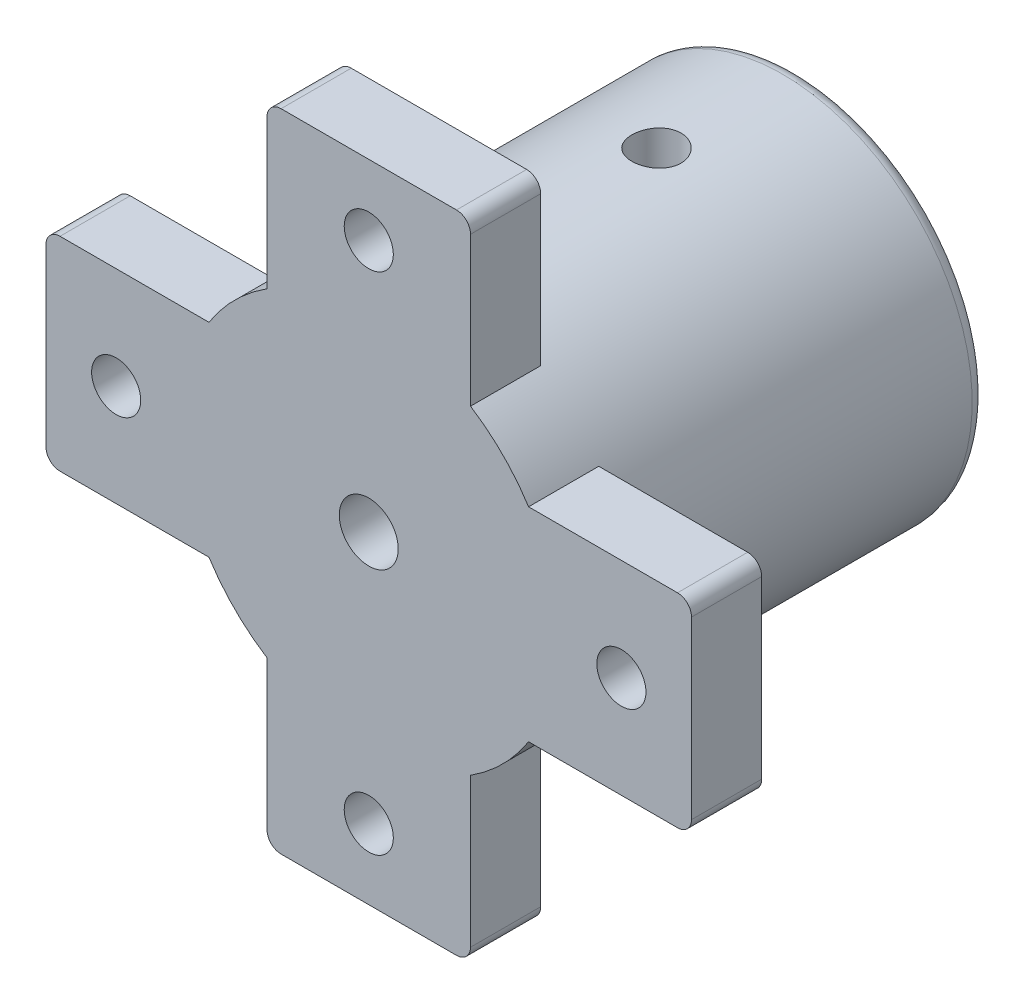
from build123d import *
from build123d.topology import SkipClean

# Parameters (mm, degrees)
SKETCH1_R               = 13.5
SKETCH1_R_2             = 2.1
BOSS_EXTRUDE1_DEPTH     = 5.5
SKETCH2_R               = 13.5
SKETCH2_R_2             = 2.1
BOSS_EXTRUDE2_DEPTH     = 5
SKETCH4_W               = 14.5
SKETCH4_H               = 15
SKETCH4_W_2             = 15
SKETCH4_H_2             = 14.5
BOSS_EXTRUDE4_DEPTH     = 5
CUT_EXTRUDE1_REACH      = 34.989
SKETCH5_R               = 1.75
BOSS_EXTRUDE5_START     = 20
SKETCH6_R               = 13.5
BOSS_EXTRUDE5_DEPTH     = 20
CUT_EXTRUDE2_DEPTH      = 39.183766184
CUT_EXTRUDE2_DEPTH_BACK = 39.183766184
SKETCH7_R               = 1.75
FILLET5_R               = 1
FILLET6_R               = 1


with BuildPart() as part:
    # Sketch1 → Boss-Extrude1 (new body)
    with BuildSketch(Plane.XY):
        Circle(SKETCH1_R)
        Circle(SKETCH1_R_2, mode=Mode.SUBTRACT)
    extrude(amount=BOSS_EXTRUDE1_DEPTH)

    # Sketch2 → Boss-Extrude2 (add)
    with BuildSketch(Plane.XY.offset(5.5)):
        Circle(SKETCH2_R)
        Circle(SKETCH2_R_2, mode=Mode.SUBTRACT)
    extrude(amount=BOSS_EXTRUDE2_DEPTH)

    # Sketch4 → Boss-Extrude4 (add)
    with BuildSketch(Plane.XY.offset(10.5)):
        with Locations((0, 15.5)):
            Rectangle(SKETCH4_W, SKETCH4_H)
        with Locations((15.5, 0)):
            Rectangle(SKETCH4_W_2, SKETCH4_H_2)
        with Locations((-15.5, 0)):
            Rectangle(SKETCH4_W_2, SKETCH4_H_2)
        with Locations((0, -15.5)):
            Rectangle(SKETCH4_W, SKETCH4_H)
    extrude(amount=-BOSS_EXTRUDE4_DEPTH)

    # Sketch5 → Cut-Extrude1 (cut, up to next)
    with BuildSketch(Plane(origin=(0, 0, 5.5), x_dir=(-1, 0, 0), z_dir=(0, 0, -1)), mode=Mode.PRIVATE) as cut_extrude1_sk1:
        with Locations((18, 0)):
            Circle(SKETCH5_R)
    cut_extrude1_tool1 = extrude(cut_extrude1_sk1.sketch, amount=-CUT_EXTRUDE1_REACH, mode=Mode.PRIVATE) & part.part
    # Sketch5 → Cut-Extrude1 (cut, up to next)
    with BuildSketch(Plane(origin=(0, 0, 5.5), x_dir=(-1, 0, 0), z_dir=(0, 0, -1)), mode=Mode.PRIVATE) as cut_extrude1_sk2:
        with Locations((-18, 0)):
            Circle(SKETCH5_R)
    cut_extrude1_tool2 = extrude(cut_extrude1_sk2.sketch, amount=-CUT_EXTRUDE1_REACH, mode=Mode.PRIVATE) & part.part
    # Sketch5 → Cut-Extrude1 (cut, up to next)
    with BuildSketch(Plane(origin=(0, 0, 5.5), x_dir=(-1, 0, 0), z_dir=(0, 0, -1)), mode=Mode.PRIVATE) as cut_extrude1_sk3:
        with Locations((0, 18)):
            Circle(SKETCH5_R)
    cut_extrude1_tool3 = extrude(cut_extrude1_sk3.sketch, amount=-CUT_EXTRUDE1_REACH, mode=Mode.PRIVATE) & part.part
    # Sketch5 → Cut-Extrude1 (cut, up to next)
    with BuildSketch(Plane(origin=(0, 0, 5.5), x_dir=(-1, 0, 0), z_dir=(0, 0, -1)), mode=Mode.PRIVATE) as cut_extrude1_sk4:
        with Locations((0, -18)):
            Circle(SKETCH5_R)
    cut_extrude1_tool4 = extrude(cut_extrude1_sk4.sketch, amount=-CUT_EXTRUDE1_REACH, mode=Mode.PRIVATE) & part.part
    add(cut_extrude1_tool1.solids().sort_by_distance((-18, 0, 5.5))[0], mode=Mode.SUBTRACT)
    add(cut_extrude1_tool2.solids().sort_by_distance((18, 0, 5.5))[0], mode=Mode.SUBTRACT)
    add(cut_extrude1_tool3.solids().sort_by_distance((0, 18, 5.5))[0], mode=Mode.SUBTRACT)
    add(cut_extrude1_tool4.solids().sort_by_distance((0, -18, 5.5))[0], mode=Mode.SUBTRACT)

    # Sketch6 → Boss-Extrude5 (add)
    with SkipClean():  # the faces are left unmerged after this step: merging them gives an invalid solid
        with BuildSketch(Plane(origin=(0, 0, 0), x_dir=(-1, 0, 0), z_dir=(0, 0, -1)).offset(BOSS_EXTRUDE5_START)):
            Circle(SKETCH6_R)
            with BuildLine():
                Line((-5.3, 7.8), (5.3, 7.8))
                ThreePointArc((5.3, 7.8), (7.067766953, 7.067766953), (7.8, 5.3))
                Line((7.8, 5.3), (7.8, -5.3))
                ThreePointArc((7.8, -5.3), (7.067766953, -7.067766953), (5.3, -7.8))
                Line((5.3, -7.8), (-5.3, -7.8))
                ThreePointArc((-5.3, -7.8), (-7.067766953, -7.067766953), (-7.8, -5.3))
                Line((-7.8, -5.3), (-7.8, 5.3))
                ThreePointArc((-7.8, 5.3), (-7.067766953, 7.067766953), (-5.3, 7.8))
            make_face(mode=Mode.SUBTRACT)
        extrude(amount=-BOSS_EXTRUDE5_DEPTH)

    # Sketch7 → Cut-Extrude2 (cut, two sides: drawn at the far end of the back side and taken through both)
    with SkipClean():  # the faces are left unmerged after this step: merging them gives an invalid solid
        with BuildSketch(Plane(origin=(0, 0, 0), x_dir=(1, 0, 0), z_dir=(0, 1, 0)).offset(-CUT_EXTRUDE2_DEPTH_BACK)):
            with Locations((0, 10)):
                Circle(SKETCH7_R)
        extrude(amount=CUT_EXTRUDE2_DEPTH + CUT_EXTRUDE2_DEPTH_BACK, mode=Mode.SUBTRACT)

    # Fillet5
    fillet5_edges = [part.edges().sort_by_distance(p)[0] for p in [
        (7.067766953, 7.067766953, -20),
        (0, 7.8, -20),
        (-7.067766953, 7.067766953, -20),
        (-7.8, 0, -20),
        (-7.067766953, -7.067766953, -20),
        (0, -7.8, -20),
        (7.067766953, -7.067766953, -20),
        (7.8, 0, -20),
        (13.5, 0, -20),
    ]]
    fillet(fillet5_edges, radius=FILLET5_R)

    # Fillet6
    fillet6_edges = [part.edges().sort_by_distance(p)[0] for p in [
        (-23, 7.25, 8),
        (-23, -7.25, 8),
        (-7.25, -23, 8),
        (7.25, -23, 8),
        (23, -7.25, 8),
        (-7.25, 23, 8),
        (7.25, 23, 8),
        (23, 7.25, 8),
    ]]
    fillet(fillet6_edges, radius=FILLET6_R)


solid = part.part
